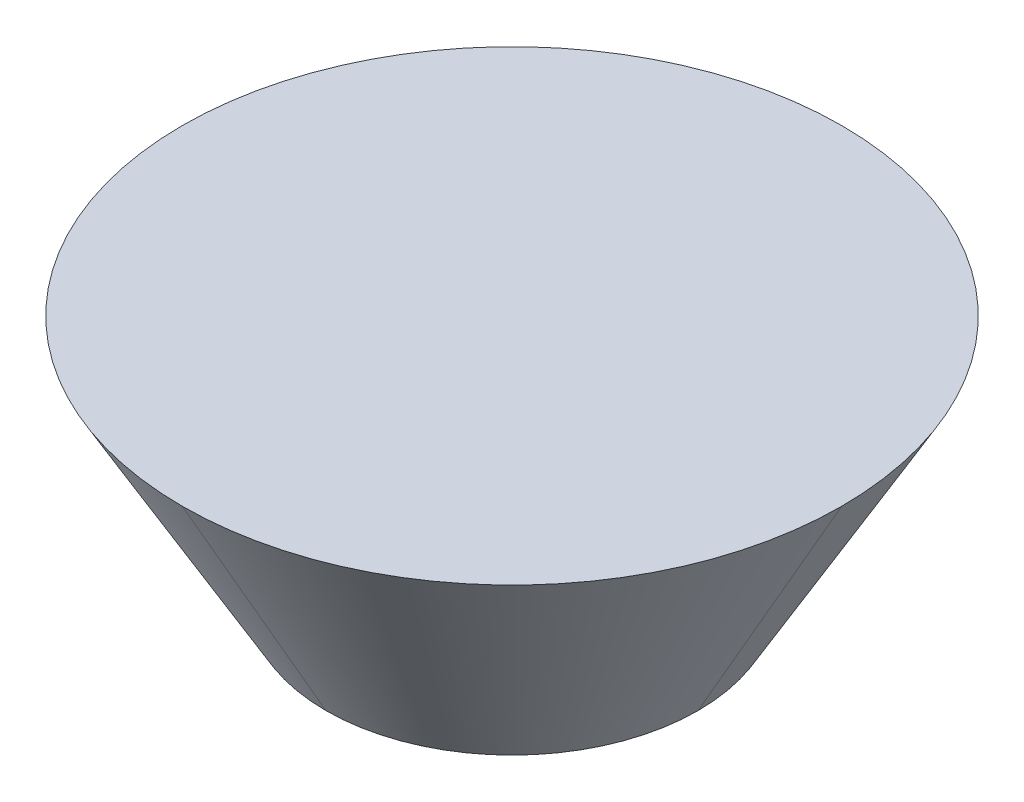
from build123d import *

# Parameters (mm, degrees)
SKETCH1_W           = 50
SKETCH1_H           = 50
BOSS_EXTRUDE1_DEPTH = 18
FILLET1_R           = 25
CHAMFER1_SIZE       = 11.547005384
CHAMFER1_SIZE_2     = 20


# Some blends are built 0.0001 mm under size
with BuildPart() as part:
    # Sketch1 → Boss-Extrude1 (new body)
    with BuildSketch(Plane(origin=(0, 0, 0), x_dir=(1, 0, 0), z_dir=(0, 1, 0))):
        Rectangle(SKETCH1_W, SKETCH1_H)
    extrude(amount=BOSS_EXTRUDE1_DEPTH)

    # Fillet1
    fillet1_edges = [part.edges().sort_by_distance(p)[0] for p in [
        (-25, 9, -25),
        (25, 9, -25),
        (25, 9, 25),
        (-25, 9, 25),
    ]]
    fillet(fillet1_edges, radius=FILLET1_R - 0.0001)  # a hair under: the kernel refuses the full size

    # Chamfer1
    # the kernel refuses this chamfer: 20, 11.547005384 mm, written as the material it takes off along each edge
    with BuildSketch(Plane(origin=(0.0001, 0, 0.0001), x_dir=(0, 0, 1), z_dir=(-1, 0, 0))) as chamfer1_piece_1:
        Polygon((24.9999 - CHAMFER1_SIZE, 0), (24.9999, CHAMFER1_SIZE_2), (24.9999, 0), align=None)
    revolve(axis=Axis((0.0001, 0, 0.0001), (0, 1, 0)), revolution_arc=90, mode=Mode.SUBTRACT)
    with BuildSketch(Plane(origin=(0.0001, 0, -0.0001), x_dir=(1, 0, 0), z_dir=(0, 0, 1))) as chamfer1_piece_2:
        Polygon((24.9999 - CHAMFER1_SIZE, 0), (24.9999, CHAMFER1_SIZE_2), (24.9999, 0), align=None)
    revolve(axis=Axis((0.0001, 0, -0.0001), (0, 1, 0)), revolution_arc=90, mode=Mode.SUBTRACT)
    with BuildSketch(Plane(origin=(-0.0001, 0, -0.0001), x_dir=(0, 0, -1), z_dir=(1, 0, 0))) as chamfer1_piece_3:
        Polygon((24.9999 - CHAMFER1_SIZE, 0), (24.9999, CHAMFER1_SIZE_2), (24.9999, 0), align=None)
    revolve(axis=Axis((-0.0001, 0, -0.0001), (0, 1, 0)), revolution_arc=90, mode=Mode.SUBTRACT)
    with BuildSketch(Plane(origin=(-0.0001, 0, 0.0001), x_dir=(0, 0, 1), z_dir=(1, 0, 0))) as chamfer1_piece_4:
        Polygon((24.9999 - CHAMFER1_SIZE, 0), (24.9999, -CHAMFER1_SIZE_2), (24.9999, 0), align=None)
    revolve(axis=Axis((-0.0001, 0, 0.0001), (0, -1, 0)), revolution_arc=90, mode=Mode.SUBTRACT)
    with BuildSketch(Plane(origin=(-0.0001, 0, 25), x_dir=(0, 0.9998132206222079, 0.019326765612700806), z_dir=(1, 0, 0))) as chamfer1_piece_5:
        Polygon((CHAMFER1_SIZE_2 * 0.999813220622, -CHAMFER1_SIZE_2 * 0.0193267656127), (-CHAMFER1_SIZE * 0.0193267656124, -CHAMFER1_SIZE * 0.999813220604), (0, 0), align=None)
    extrude(amount=0.0002, mode=Mode.SUBTRACT)
    with BuildSketch(Plane(origin=(-25, 0, -0.0001), x_dir=(0.9983227437537926, -0.05789386240267081, 0), z_dir=(0, 0, 1)), Plane(origin=(0.0001, 0, -25), x_dir=(0, -0.05789386240267081, 0.9983227437537926), z_dir=(-1, 0, 0)), Plane(origin=(25, 0, 0.0001), x_dir=(-0.9983227437537926, -0.05789386240267081, 0), z_dir=(0, 0, -1))) as chamfer1_piece_6:
        Polygon((CHAMFER1_SIZE * 0.998322743736, CHAMFER1_SIZE * 0.0578938624016), (-CHAMFER1_SIZE_2 * 0.0578938624027, CHAMFER1_SIZE_2 * 0.998322743754), (0, 0), align=None)
    extrude(amount=0.0002, mode=Mode.SUBTRACT)


solid = part.part
